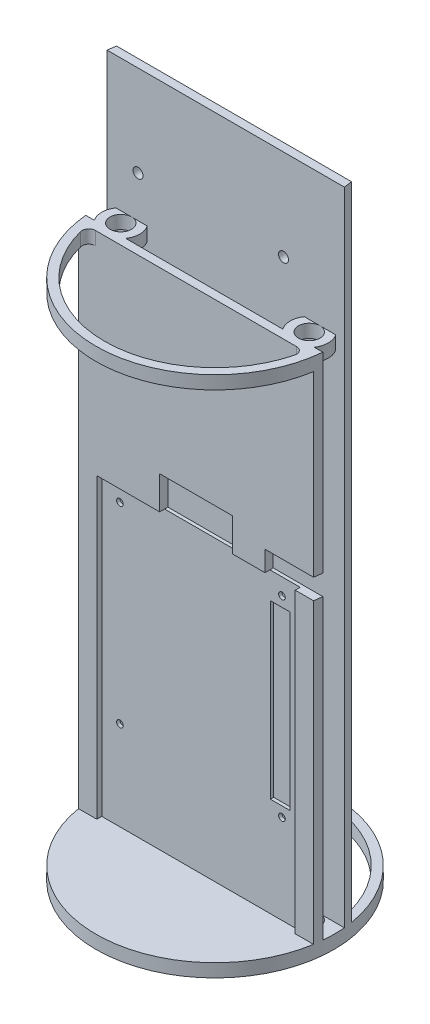
from build123d import *

# Parameters (mm, degrees)
SKETCH1_R           = 36
BOSS_EXTRUDE1_DEPTH = 4
BOSS_EXTRUDE2_DEPTH = 90
SKETCH4_R           = 3.25
CUT_EXTRUDE2_DEPTH  = 10
SKETCH3_W           = 60
SKETCH3_H           = 1.5
CUT_EXTRUDE1_DEPTH  = 90
SKETCH6_W           = 6
SKETCH6_H           = 52
CUT_EXTRUDE4_DEPTH  = 5
SKETCH7_R           = 1
CUT_EXTRUDE5_DEPTH  = 5
BOSS_EXTRUDE3_DEPTH = 60
SKETCH10_W          = 22
SKETCH10_H          = 10
CUT_EXTRUDE6_DEPTH  = 5
SKETCH11_R          = 3.25
BOSS_EXTRUDE4_DEPTH = 4
BOSS_EXTRUDE5_DEPTH = 40
SKETCH13_W          = 15
SKETCH13_H          = 6.157248713
CUT_EXTRUDE8_DEPTH  = 4
SKETCH8_R           = 1.5
CUT_EXTRUDE7_DEPTH  = 5
CUT_EXTRUDE9_DEPTH  = 5


with BuildPart() as part:
    # Sketch1 → Boss-Extrude1 (new body)
    with BuildSketch(Plane(origin=(0, 0, 0), x_dir=(1, 0, 0), z_dir=(0, 1, 0))):
        Circle(SKETCH1_R)
    extrude(amount=BOSS_EXTRUDE1_DEPTH)

    # Sketch2 → Boss-Extrude2 (add)
    with BuildSketch(Plane(origin=(0, 4, 0), x_dir=(1, 0, 0), z_dir=(0, 1, 0))):
        with BuildLine():
            ThreePointArc((35.537831954, -5.75), (35.717295076, -4.50275832), (35.85299848, -3.25))
            Line((35.85299848, -3.25), (-35.85299848, -3.25))
            ThreePointArc((-35.85299848, -3.25), (-35.717295076, -4.50275832), (-35.537831954, -5.75))
            Line((-35.537831954, -5.75), (35.537831954, -5.75))
        make_face()
        with BuildLine():
            ThreePointArc((35.85299848, 3.25), (35.717295076, 4.50275832), (35.537831954, 5.75))
            Line((35.537831954, 5.75), (-35.537831954, 5.75))
            ThreePointArc((-35.537831954, 5.75), (-35.717295076, 4.50275832), (-35.85299848, 3.25))
            Line((-35.85299848, 3.25), (35.85299848, 3.25))
        make_face()
    extrude(amount=BOSS_EXTRUDE2_DEPTH)

    # Sketch4 → Cut-Extrude2 (cut)
    with BuildSketch(Plane(origin=(0, 4, 0), x_dir=(1, 0, 0), z_dir=(0, 1, 0))):
        with Locations((-28.5, 0)):
            Circle(SKETCH4_R)
        with Locations((28.5, 0)):
            Circle(SKETCH4_R)
    extrude(amount=-CUT_EXTRUDE2_DEPTH, mode=Mode.SUBTRACT)

    # Sketch3 → Cut-Extrude1 (cut)
    with BuildSketch(Plane(origin=(0, 94, 0), x_dir=(1, 0, 0), z_dir=(0, 1, 0))):
        with Locations((0, -5)):
            Rectangle(SKETCH3_W, SKETCH3_H)
    extrude(amount=-CUT_EXTRUDE1_DEPTH, mode=Mode.SUBTRACT)

    # Sketch6 → Cut-Extrude4 (cut)
    with BuildSketch(Plane.XY.offset(4.25)):
        with Locations((24, 60)):
            Rectangle(SKETCH6_W, SKETCH6_H)
    extrude(amount=-CUT_EXTRUDE4_DEPTH, mode=Mode.SUBTRACT)

    # Sketch7 → Cut-Extrude5 (cut)
    with BuildSketch(Plane.XY.offset(4.25)):
        with Locations((-24.5, 89)):
            Circle(SKETCH7_R)
        with Locations((24.5, 89)):
            Circle(SKETCH7_R)
        with Locations((24.5, 31)):
            Circle(SKETCH7_R)
        with Locations((-24.5, 31)):
            Circle(SKETCH7_R)
    extrude(amount=-CUT_EXTRUDE5_DEPTH, mode=Mode.SUBTRACT)

    # Sketch9 → Boss-Extrude3 (add)
    with BuildSketch(Plane(origin=(0, 94, 0), x_dir=(1, 0, 0), z_dir=(0, 1, 0))):
        with BuildLine():
            Line((-35.85299848, 3.25), (35.85299848, 3.25))
            ThreePointArc((35.85299848, 3.25), (35.717295076, 4.50275832), (35.537831954, 5.75))
            Line((35.537831954, 5.75), (-35.537831954, 5.75))
            ThreePointArc((-35.537831954, 5.75), (-35.717295076, 4.50275832), (-35.85299848, 3.25))
        make_face()
        with BuildLine():
            Line((-35.537831954, -5.75), (35.537831954, -5.75))
            ThreePointArc((35.537831954, -5.75), (35.717295076, -4.50275832), (35.85299848, -3.25))
            Line((35.85299848, -3.25), (-35.85299848, -3.25))
            ThreePointArc((-35.85299848, -3.25), (-35.717295076, -4.50275832), (-35.537831954, -5.75))
        make_face()
    extrude(amount=BOSS_EXTRUDE3_DEPTH)

    # Sketch10 → Cut-Extrude6 (cut)
    with BuildSketch(Plane.XY.offset(5.75)):
        with Locations((0, 99)):
            Rectangle(SKETCH10_W, SKETCH10_H)
    extrude(amount=-CUT_EXTRUDE6_DEPTH, mode=Mode.SUBTRACT)

    # Sketch11 → Boss-Extrude4 (add)
    with BuildSketch(Plane(origin=(0, 154, 0), x_dir=(1, 0, 0), z_dir=(0, 1, 0))):
        with BuildLine():
            Line((-35.85299848, 3.25), (-33.24341649, 3.25))
            ThreePointArc((-33.24341649, 3.25), (-34.25, 0), (-33.24341649, -3.25))
            Line((-33.24341649, -3.25), (-35.85299848, -3.25))
            ThreePointArc((-35.85299848, -3.25), (0, -36), (35.85299848, -3.25))
            Line((35.85299848, -3.25), (33.24341649, -3.25))
            ThreePointArc((33.24341649, -3.25), (34.25, 0), (33.24341649, 3.25))
            Line((33.24341649, 3.25), (35.85299848, 3.25))
            ThreePointArc((35.85299848, 3.25), (35.717295076, 4.50275832), (35.537831954, 5.75))
            Line((35.537831954, 5.75), (-35.537831954, 5.75))
            ThreePointArc((-35.537831954, 5.75), (-35.717295076, 4.50275832), (-35.85299848, 3.25))
        make_face()
        with BuildLine():
            Line((-23.75658351, 3.25), (23.75658351, 3.25))
            ThreePointArc((23.75658351, 3.25), (22.75, 0), (23.75658351, -3.25))
            Line((23.75658351, -3.25), (-23.75658351, -3.25))
            ThreePointArc((-23.75658351, -3.25), (-22.75, 0), (-23.75658351, 3.25))
        make_face(mode=Mode.SUBTRACT)
        with BuildLine():
            ThreePointArc((32.368662138, -8.243600631), (0, -33.401904735), (-32.368662138, -8.243600631))
            ThreePointArc((-32.368662138, -8.243600631), (-32.009643299, -6.522645378), (-30.430529424, -5.75))
            Line((-30.430529424, -5.75), (30.430529424, -5.75))
            ThreePointArc((30.430529424, -5.75), (32.009643299, -6.522645378), (32.368662138, -8.243600631))
        make_face(mode=Mode.SUBTRACT)
        with Locations((28.5, 0)):
            Circle(SKETCH11_R, mode=Mode.SUBTRACT)
        with Locations((-28.5, 0)):
            Circle(SKETCH11_R, mode=Mode.SUBTRACT)
    extrude(amount=BOSS_EXTRUDE4_DEPTH)

    # Sketch12 → Boss-Extrude5 (add)
    with BuildSketch(Plane(origin=(0, 158, 0), x_dir=(1, 0, 0), z_dir=(0, 1, 0))):
        with BuildLine():
            Line((35.537831954, 5.75), (-35.537831954, 5.75))
            ThreePointArc((-35.537831954, 5.75), (-35.717295076, 4.50275832), (-35.85299848, 3.25))
            Line((-35.85299848, 3.25), (35.85299848, 3.25))
            ThreePointArc((35.85299848, 3.25), (35.717295076, 4.50275832), (35.537831954, 5.75))
        make_face()
    extrude(amount=BOSS_EXTRUDE5_DEPTH)

    # Sketch13 → Cut-Extrude8 (cut)
    with BuildSketch(Plane.XY.offset(5.75)):
        with Locations((28.35299848, 97.078624357)):
            Rectangle(SKETCH13_W, SKETCH13_H)
    extrude(amount=-CUT_EXTRUDE8_DEPTH, mode=Mode.SUBTRACT)

    # Sketch8 → Cut-Extrude7 (cut)
    with BuildSketch(Plane(origin=(0, 0, -5.75), x_dir=(-1, 0, 0), z_dir=(0, 0, -1))):
        with Locations((-17.462168046, 170.5)):
            Circle(SKETCH8_R)
        with Locations((26.537831954, 170.5)):
            Circle(SKETCH8_R)
        with Locations((26.537831954, 82.5)):
            Circle(SKETCH8_R)
        with Locations((-17.462168046, 82.5)):
            Circle(SKETCH8_R)
    extrude(amount=-CUT_EXTRUDE7_DEPTH, mode=Mode.SUBTRACT)

    # Sketch15 → Cut-Extrude9 (cut)
    with BuildSketch(Plane.XZ):
        with BuildLine():
            Line((-23.75658351, -3.25), (23.75658351, -3.25))
            ThreePointArc((23.75658351, -3.25), (22.75, 0), (23.75658351, 3.25))
            Line((23.75658351, 3.25), (-23.75658351, 3.25))
            ThreePointArc((-23.75658351, 3.25), (-22.75, 0), (-23.75658351, -3.25))
        make_face()
        with BuildLine():
            Line((30.44433134, -5.75), (-30.44433134, -5.75))
            ThreePointArc((-30.44433134, -5.75), (-32.023378673, -6.522559769), (-32.382517563, -8.243390479))
            ThreePointArc((-32.382517563, -8.243390479), (0, -33.415279893), (32.382517563, -8.243390479))
            ThreePointArc((32.382517563, -8.243390479), (32.023378673, -6.522559769), (30.44433134, -5.75))
        make_face()
    extrude(amount=-CUT_EXTRUDE9_DEPTH, mode=Mode.SUBTRACT)


solid = part.part
